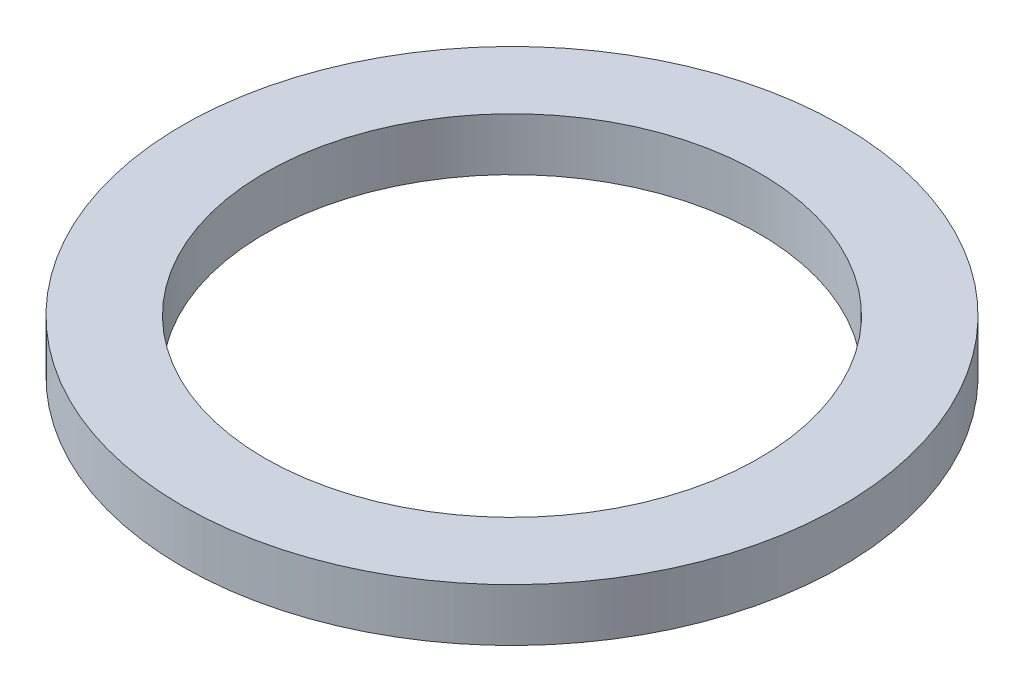
from build123d import *

# Parameters (mm, degrees)
SKETCH1_R           = 50
BOSS_EXTRUDE1_DEPTH = 8
SKETCH2_R           = 37.5
CUT_EXTRUDE1_DEPTH  = 72.161787499


with BuildPart() as part:
    # Sketch1 → Boss-Extrude1 (new body)
    with BuildSketch(Plane(origin=(0, 0, 0), x_dir=(1, 0, 0), z_dir=(0, 1, 0))):
        Circle(SKETCH1_R)
    extrude(amount=BOSS_EXTRUDE1_DEPTH)

    # Sketch2 → Cut-Extrude1 (cut, through all)
    with BuildSketch(Plane(origin=(0, 0, 0), x_dir=(1, 0, 0), z_dir=(0, 1, 0))):
        Circle(SKETCH2_R)
    extrude(amount=CUT_EXTRUDE1_DEPTH, mode=Mode.SUBTRACT)


solid = part.part
